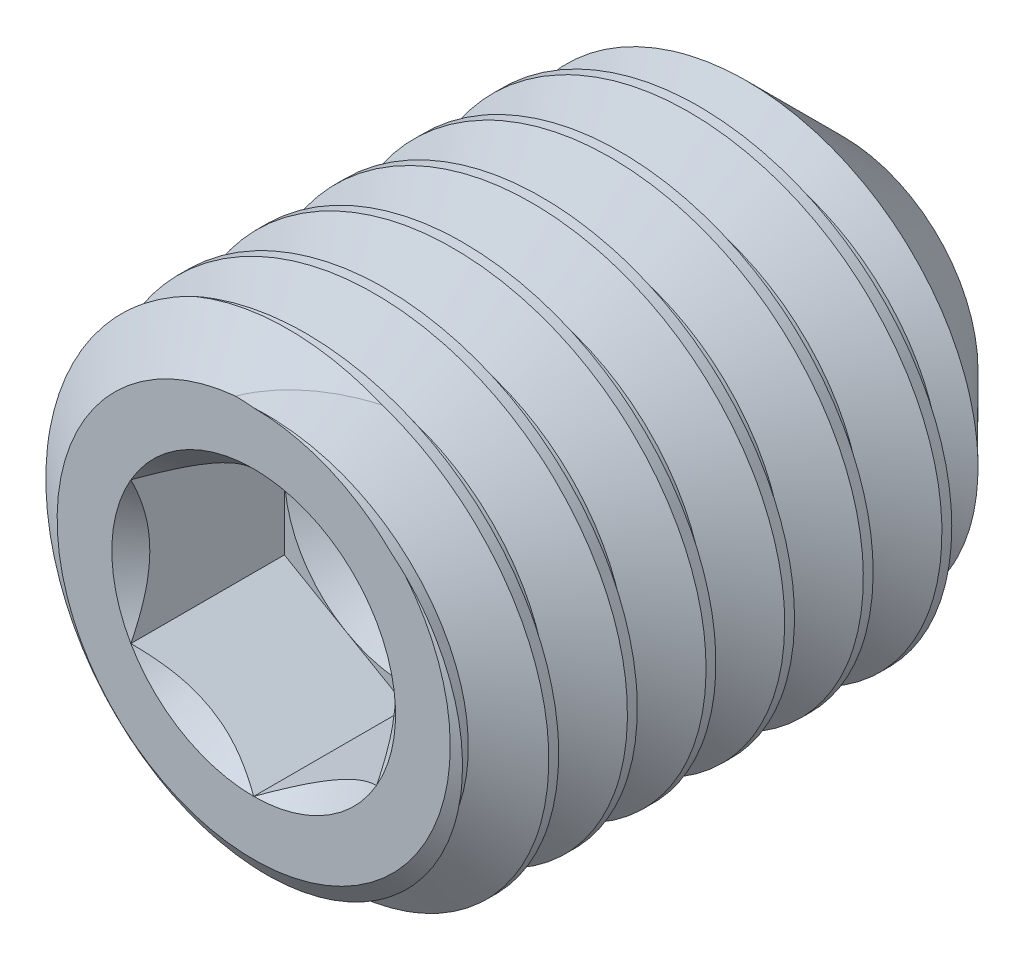
from build123d import *

# Parameters (mm, degrees)
CUT_SWEEP2_PITCH    = 0.8
CUT_EXTRUDE10_DEPTH = 1.5625


with BuildPart() as part:
    # Sketch22 → Revolve1 (revolve)
    with BuildSketch(Plane(origin=(0, 0, 0), x_dir=(0, 0, -1), z_dir=(1, 0, 0)), mode=Mode.PRIVATE) as revolve1_sk:
        Polygon((-2.588436834, 0), (-2.588436834, 2), (-2.238333065, 2.5), (2.281475432, 2.5), (3.411563166, 1.369912266), (2.588436834, 0), align=None)
    revolve(revolve1_sk.sketch.rotate(Axis((0, 0, -2.588436834), (0, 0, -1)), 180), axis=Axis((0, 0, -2.588436834), (0, 0, -1)))

    # Cut-Sweep2: the profile of Sketch28 profile screwed along a right-hand helix of 8.5 turns, 8 arcs to a turn; built about Z, then put on its axis
    cut_sweep2_z = Axis((0, 0, 0), (0, 0, 1))
    cut_sweep2_corners = [(2.5003, 0, 0.000173205), (2.5003, 0, -0.700173205), (1.980384758, 0, -0.4), (1.980384758, 0, -0.3)]
    with BuildLine(mode=Mode.PRIVATE) as cut_sweep2_profile:
        Line(cut_sweep2_corners[0], cut_sweep2_corners[1])
        Line(cut_sweep2_corners[1], cut_sweep2_corners[2])
        Line(cut_sweep2_corners[2], cut_sweep2_corners[3])
        Line(cut_sweep2_corners[3], cut_sweep2_corners[0])
    cut_sweep2_cap = Face(cut_sweep2_profile.wire())
    cut_sweep2_turn_angles = [0, 22.5, 45, 67.5, 90, 112.5, 135, 157.5, 180, 202.5, 225, 247.5, 270, 292.5, 315, 337.5, 360]
    cut_sweep2_turn_weights = [1, 0.9238795325112867, 1, 0.9238795325112867, 1, 0.9238795325112867, 1, 0.9238795325112867, 1, 0.9238795325112867, 1, 0.9238795325112867, 1, 0.9238795325112867, 1, 0.9238795325112867, 1]
    cut_sweep2_turn_rails = [Edge.make_bspline([Vector(p[0], p[1], 0).rotate(cut_sweep2_z, cut_sweep2_turn_angles[k]) / cut_sweep2_turn_weights[k] + Vector(0, 0, p[2] + CUT_SWEEP2_PITCH * cut_sweep2_turn_angles[k] / 360) for k in range(17)], [0, 0, 0, 1, 1, 2, 2, 3, 3, 4, 4, 5, 5, 6, 6, 7, 7, 8, 8, 8], 2, cut_sweep2_turn_weights) for p in cut_sweep2_corners]
    cut_sweep2_turn_sides = [Face.make_surface_from_curves(cut_sweep2_turn_rails[p[0]], cut_sweep2_turn_rails[p[1]]) for p in [(0, 1), (1, 2), (2, 3), (3, 0)]]
    cut_sweep2_last_angles = [2880, 2902.5, 2925, 2947.5, 2970, 2992.5, 3015, 3037.5, 3060]
    cut_sweep2_last_weights = [1, 0.9238795325112867, 1, 0.9238795325112867, 1, 0.9238795325112867, 1, 0.9238795325112867, 1]
    cut_sweep2_last_rails = [Edge.make_bspline([Vector(p[0], p[1], 0).rotate(cut_sweep2_z, cut_sweep2_last_angles[k]) / cut_sweep2_last_weights[k] + Vector(0, 0, p[2] + CUT_SWEEP2_PITCH * cut_sweep2_last_angles[k] / 360) for k in range(9)], [0, 0, 0, 1, 1, 2, 2, 3, 3, 4, 4, 4], 2, cut_sweep2_last_weights) for p in cut_sweep2_corners]
    cut_sweep2_last_sides = [Face.make_surface_from_curves(cut_sweep2_last_rails[p[0]], cut_sweep2_last_rails[p[1]]) for p in [(0, 1), (1, 2), (2, 3), (3, 0)]]
    cut_sweep2 = Plane(origin=(0, 0, -3.411563166), x_dir=(0, 1, 0), z_dir=(0, 0, 1)) * Solid(Shell([*[p.moved(Location((0, 0, CUT_SWEEP2_PITCH * i))) for i in range(8) for p in cut_sweep2_turn_sides], *cut_sweep2_last_sides, cut_sweep2_cap, cut_sweep2_cap.rotate(cut_sweep2_z, 3060).moved(Location((0, 0, CUT_SWEEP2_PITCH * 3060 / 360)))]))
    add(cut_sweep2, mode=Mode.SUBTRACT)

    # Sketch23 → Cut-Extrude10 (cut)
    with BuildSketch(Plane.XY.offset(2.588436834)):
        Polygon((0, 1.443375673), (-1.25, 0.721687836), (-1.25, -0.721687836), (0, -1.443375673), (1.25, -0.721687836), (1.25, 0.721687836), align=None)
    extrude(amount=-CUT_EXTRUDE10_DEPTH, mode=Mode.SUBTRACT)

    # Cut-Extrude11 cone 1 section (through the dimple's axis) → Cut-Extrude11 (revolve, cut)
    with BuildSketch(Plane(origin=(0, 0, 2.588436834), x_dir=(0, -1, 0), z_dir=(1, 0, 0))):
        Polygon((0, 0), (1.443375673, 0), (0, 1.443375673), align=None)
    revolve(axis=Axis((0, 0, 2.588436834), (0, 0, -1)), mode=Mode.SUBTRACT)

    # Cut-Extrude12 cone 1 section (through the dimple's axis) → Cut-Extrude12 (revolve, cut)
    with BuildSketch(Plane(origin=(0, 0, 1.025936834), x_dir=(0, -1, 0), z_dir=(1, 0, 0))):
        Polygon((0, 0), (1.25, 0), (0, 0.721687836), align=None)
    revolve(axis=Axis((0, 0, 1.025936834), (0, 0, -1)), mode=Mode.SUBTRACT)


solid = part.part
